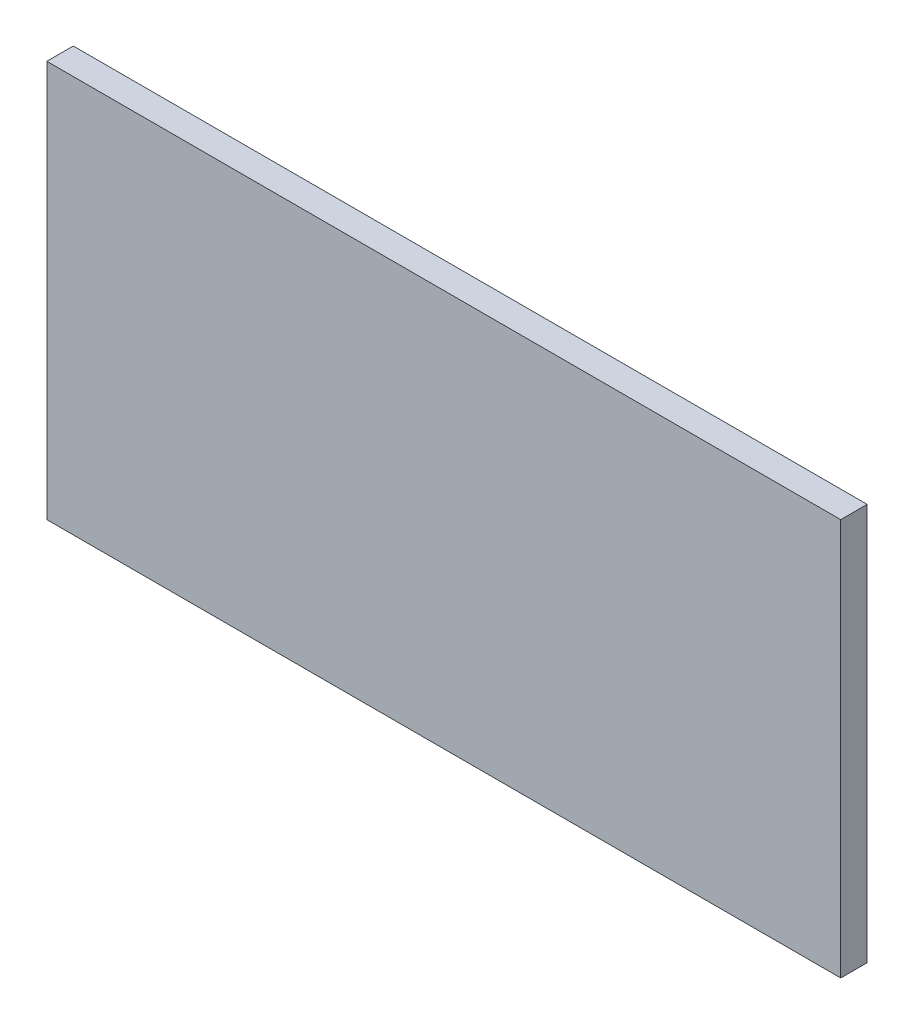
from build123d import *

# Parameters (mm, degrees)
SKETCH_1_W      = 180
SKETCH_1_H      = 90
EXTRUDE_1_DEPTH = 6


with BuildPart() as part:
    # Эскиз1 → Бобышка-Вытянуть1 (new body)
    with BuildSketch(Plane.XY):
        Rectangle(SKETCH_1_W, SKETCH_1_H)
    extrude(amount=EXTRUDE_1_DEPTH)


solid = part.part
